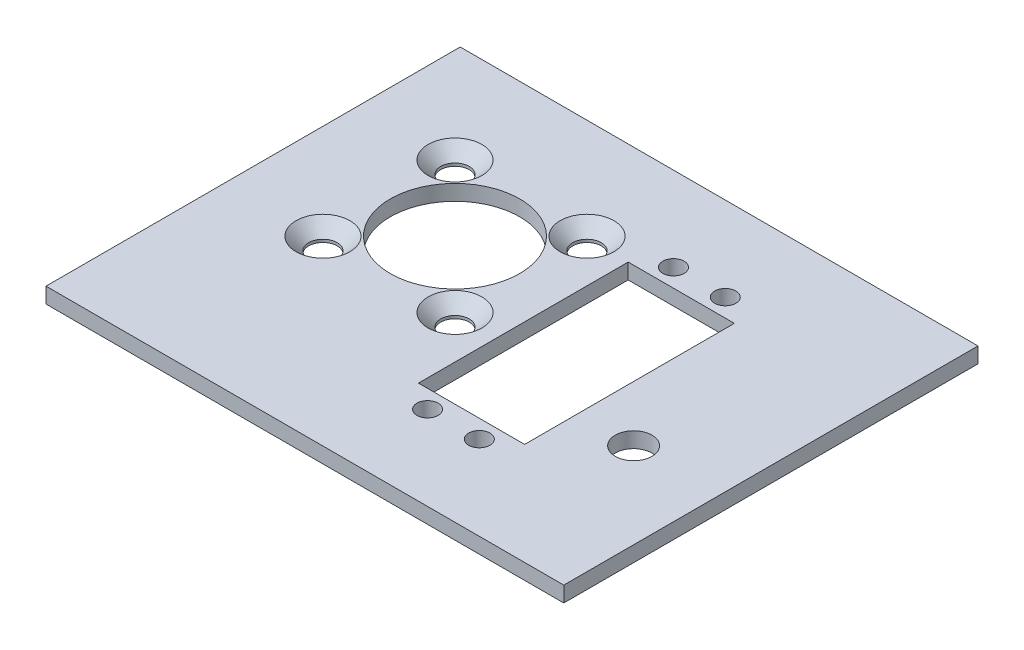
from build123d import *

# Parameters (mm, degrees)
SZKIC1_W                                     = 100
SZKIC1_H                                     = 80
SZKIC1_R                                     = 2.55
SZKIC1_R_2                                   = 2.05
SZKIC1_R_3                                   = 3.55
SZKIC1_R_4                                   = 12.5
SZKIC1_W_2                                   = 20.5
SZKIC1_H_2                                   = 40.5
DODANIE_WYCI_GNI_CIE1_DEPTH                  = 3
CSK_FOR_M5_COUNTERSUNK_FLAT_HEAD_SCR_2_COUNT = 2
CSK_FOR_M5_COUNTERSUNK_FLAT_HEAD_SCR_2_PITCH = 25.5
CSK_FOR_M5_COUNTERSUNK_FLAT_HEAD_SCR_3_COUNT = 2
CSK_FOR_M5_COUNTERSUNK_FLAT_HEAD_SCR_3_PITCH = 36.062445841
CSK_FOR_M5_COUNTERSUNK_FLAT_HEAD_SCR_4_COUNT = 2
CSK_FOR_M5_COUNTERSUNK_FLAT_HEAD_SCR_4_PITCH = 25.5


with BuildPart() as part:
    # Szkic1 → Dodanie-wyciągnięcie1 (new body)
    with BuildSketch(Plane(origin=(0, 0, 0), x_dir=(1, 0, 0), z_dir=(0, 1, 0))):
        with Locations((11.336719097, -8.838965942)):
            Rectangle(SZKIC1_W, SZKIC1_H)
        with Locations((-20.268770099, -13.743104788)):
            Circle(SZKIC1_R, mode=Mode.SUBTRACT)
        with Locations((5.231229901, -13.743104788)):
            Circle(SZKIC1_R, mode=Mode.SUBTRACT)
        with Locations((18.775116298, -32.588965942)):
            Circle(SZKIC1_R_2, mode=Mode.SUBTRACT)
        with Locations((28.775116298, -32.588965942)):
            Circle(SZKIC1_R_2, mode=Mode.SUBTRACT)
        with Locations((44.775116298, -18.788965942)):
            Circle(SZKIC1_R_3, mode=Mode.SUBTRACT)
        with Locations((-7.518770099, -0.993104788)):
            Circle(SZKIC1_R_4, mode=Mode.SUBTRACT)
        with Locations((-20.268770099, 11.756895212)):
            Circle(SZKIC1_R, mode=Mode.SUBTRACT)
        with Locations((5.231229901, 11.756895212)):
            Circle(SZKIC1_R, mode=Mode.SUBTRACT)
        with Locations((23.775116298, -8.838965942)):
            Rectangle(SZKIC1_W_2, SZKIC1_H_2, mode=Mode.SUBTRACT)
        with Locations((18.775116298, 14.911034058)):
            Circle(SZKIC1_R_2, mode=Mode.SUBTRACT)
        with Locations((28.775116298, 14.911034058)):
            Circle(SZKIC1_R_2, mode=Mode.SUBTRACT)
    extrude(amount=DODANIE_WYCI_GNI_CIE1_DEPTH)

    # Sketch4 → CSK for M5 Countersunk Flat Head Screw2 (revolve, cut)
    with BuildSketch(Plane(origin=(-20.268770099, 3, 13.743104788), x_dir=(0, 0, 1), z_dir=(1, 0, 0))):
        Polygon((0, 0), (0, 3), (2.75, 3), (2.75, 2.45), (5.2, 0), align=None)
    csk_for_m5_countersunk_flat_head_screw2 = revolve(axis=Axis((-20.268770099, 9.35, 13.743104788), (0, -1, 0)), mode=Mode.SUBTRACT)

    # CSK for M5 Countersunk Flat Head Scr 2: CSK for M5 Countersunk Flat Head Screw2 ×2
    with Locations(*[(i * CSK_FOR_M5_COUNTERSUNK_FLAT_HEAD_SCR_2_PITCH, 0, 0) for i in range(1, CSK_FOR_M5_COUNTERSUNK_FLAT_HEAD_SCR_2_COUNT)]):
        add(csk_for_m5_countersunk_flat_head_screw2, mode=Mode.SUBTRACT)

    # CSK for M5 Countersunk Flat Head Scr 3: CSK for M5 Countersunk Flat Head Screw2 ×2
    with Locations(*[Vector(0.7071067811865475, 0, -0.7071067811865476) * (i * CSK_FOR_M5_COUNTERSUNK_FLAT_HEAD_SCR_3_PITCH) for i in range(1, CSK_FOR_M5_COUNTERSUNK_FLAT_HEAD_SCR_3_COUNT)]):
        add(csk_for_m5_countersunk_flat_head_screw2, mode=Mode.SUBTRACT)

    # CSK for M5 Countersunk Flat Head Scr 4: CSK for M5 Countersunk Flat Head Screw2 ×2
    with Locations(*[(0, 0, -i * CSK_FOR_M5_COUNTERSUNK_FLAT_HEAD_SCR_4_PITCH) for i in range(1, CSK_FOR_M5_COUNTERSUNK_FLAT_HEAD_SCR_4_COUNT)]):
        add(csk_for_m5_countersunk_flat_head_screw2, mode=Mode.SUBTRACT)


solid = part.part
